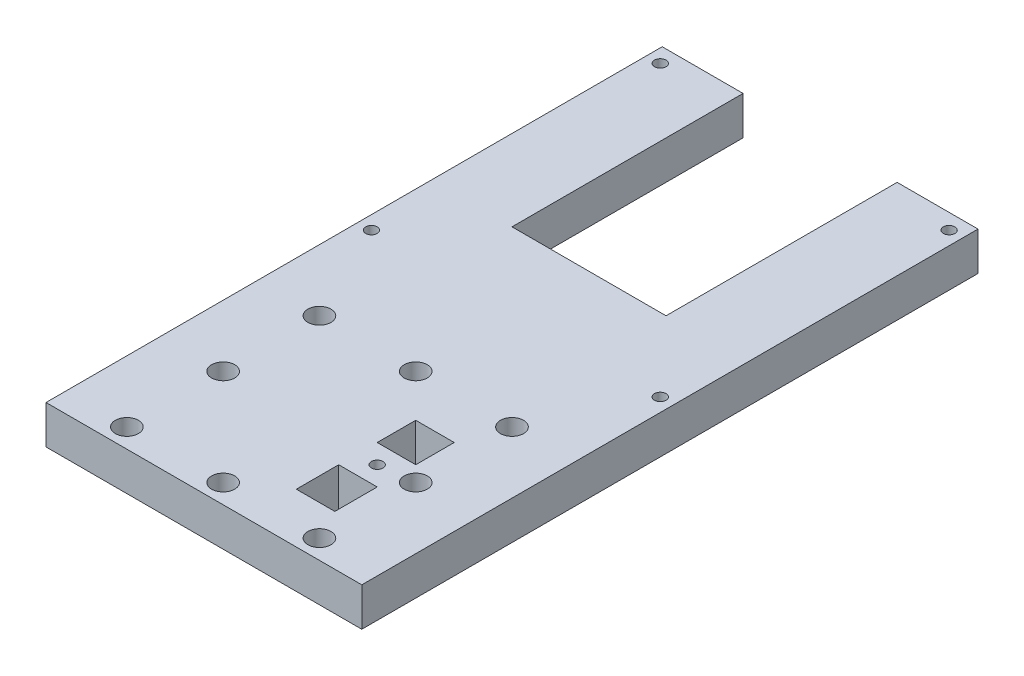
from build123d import *

# Parameters (mm, degrees)
SKETCH1_R           = 3
SKETCH1_R_2         = 1.5
SKETCH1_W           = 10
SKETCH1_H           = 11
SKETCH1_H_2         = 10
BOSS_EXTRUDE1_DEPTH = 10


with BuildPart() as part:
    # Sketch1 → Boss-Extrude1 (new body)
    with BuildSketch(Plane(origin=(0, 0, 0), x_dir=(1, 0, 0), z_dir=(0, 1, 0))):
        Polygon((32.969203123, -64.744115369), (-49.030796877, -64.744115369), (-49.030796877, 95.255884631), (-28.030796877, 95.255884631), (-28.030796877, 35.255884631), (11.969203123, 35.255884631), (11.969203123, 95.255884631), (32.969203123, 95.255884631), align=None)
        with Locations((-33.030796877, -59.744115369)):
            Circle(SKETCH1_R, mode=Mode.SUBTRACT)
        with Locations((16.969203123, -59.744115369)):
            Circle(SKETCH1_R, mode=Mode.SUBTRACT)
        with Locations((16.969203123, -9.744115369)):
            Circle(SKETCH1_R, mode=Mode.SUBTRACT)
        with Locations((-33.030796877, -9.744115369)):
            Circle(SKETCH1_R, mode=Mode.SUBTRACT)
        with Locations((-45.530796877, 91.255884631)):
            Circle(SKETCH1_R_2, mode=Mode.SUBTRACT)
        with Locations((29.469203123, 91.255884631)):
            Circle(SKETCH1_R_2, mode=Mode.SUBTRACT)
        with Locations((29.469203123, 16.255884631)):
            Circle(SKETCH1_R_2, mode=Mode.SUBTRACT)
        with Locations((-45.530796877, 16.255884631)):
            Circle(SKETCH1_R_2, mode=Mode.SUBTRACT)
        with Locations((-8.030796877, -9.744115369)):
            Circle(SKETCH1_R, mode=Mode.SUBTRACT)
        with Locations((-33.030796877, -34.744115369)):
            Circle(SKETCH1_R, mode=Mode.SUBTRACT)
        with Locations((16.969203123, -34.744115369)):
            Circle(SKETCH1_R, mode=Mode.SUBTRACT)
        with Locations((-8.030796877, -59.744115369)):
            Circle(SKETCH1_R, mode=Mode.SUBTRACT)
        with Locations((7.969203123, -35.744115369)):
            Circle(SKETCH1_R_2, mode=Mode.SUBTRACT)
        with Locations((7.969203123, -46.244115369)):
            Rectangle(SKETCH1_W, SKETCH1_H, mode=Mode.SUBTRACT)
        with Locations((7.969203123, -25.744115369)):
            Rectangle(SKETCH1_W, SKETCH1_H_2, mode=Mode.SUBTRACT)
    extrude(amount=BOSS_EXTRUDE1_DEPTH)


solid = part.part
